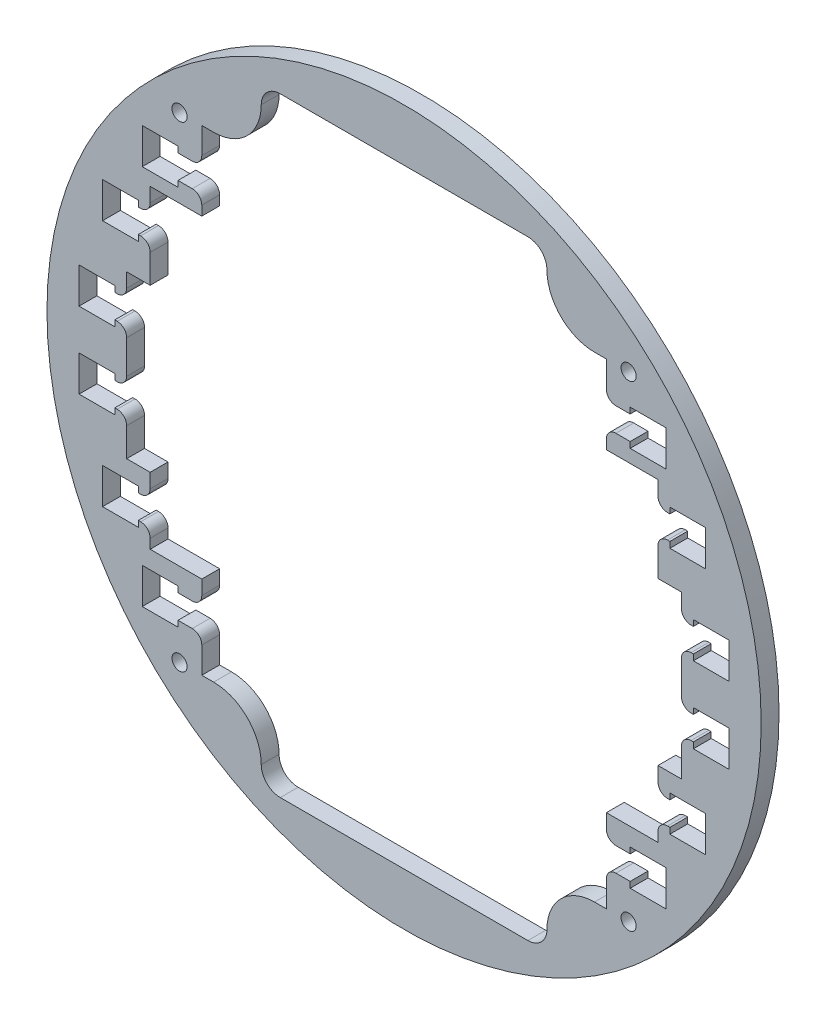
from build123d import *

# Parameters (mm, degrees)
SKETCH1_R                  = 95.25
BOSS_EXTRUDE1_DEPTH        = 4.7625
CUT_EXTRUDE1_DEPTH         = 135.788005424
SKETCH12_W                 = 136.486274728
SKETCH12_H                 = 6.35
SKETCH12_W_2               = 157.666649448
SKETCH12_W_3               = 170.194766776
CUT_EXTRUDE2_DEPTH         = 135.788005424
CUT_EXTRUDE3_DEPTH         = 135.788005424
F_10_32_TAPPED_HOLE1_D     = 4.0386
F_10_32_TAPPED_HOLE1_DEPTH = 11.938
SKETCH14_W                 = 76.2
SKETCH14_H                 = 162.56
CUT_EXTRUDE4_DEPTH         = 135.788005424
FILLET1_R                  = 12.7
FILLET2_R                  = 5.08
FILLET3_R                  = 2.54


with BuildPart() as part:
    # Sketch1 → Boss-Extrude1 (new body)
    with BuildSketch(Plane.XY):
        with Locations(Location((0, 0, 0), (0, 0, 180))):
            Circle(SKETCH1_R)
    extrude(amount=BOSS_EXTRUDE1_DEPTH)

    # Sketch11 → Cut-Extrude1 (cut, through all)
    with BuildSketch(Plane.XY.offset(4.7625)):
        Polygon((-69.830637364, 55.5625), (-69.830637364, 46.0375), (-60.305637364, 46.0375), (-60.305637364, 47.625), (-68.243137364, 47.625), (-68.243137364, 53.975), (-60.305637364, 53.975), (-60.305637364, 55.5625), align=None)
        Polygon((-86.684883388, 14.9225), (-86.684883388, 5.3975), (-77.159883388, 5.3975), (-77.159883388, 6.985), (-85.097383388, 6.985), (-85.097383388, 13.335), (-77.159883388, 13.335), (-77.159883388, 14.9225), align=None)
        Polygon((-80.420824724, 37.7825), (-80.420824724, 28.2575), (-70.895824724, 28.2575), (-70.895824724, 29.845), (-78.833324724, 29.845), (-78.833324724, 36.195), (-70.895824724, 36.195), (-70.895824724, 37.7825), align=None)
        Polygon((-77.159883388, -13.335), (-77.159883388, -14.9225), (-86.684883388, -14.9225), (-86.684883388, -5.3975), (-77.159883388, -5.3975), (-77.159883388, -6.985), (-85.097383388, -6.985), (-85.097383388, -13.335), align=None)
        Polygon((-80.420824724, -28.2575), (-70.895824724, -28.2575), (-70.895824724, -29.845), (-78.833324724, -29.845), (-78.833324724, -36.195), (-70.895824724, -36.195), (-70.895824724, -37.7825), (-80.420824724, -37.7825), align=None)
        Polygon((-60.305637364, -46.0375), (-60.305637364, -47.625), (-68.243137364, -47.625), (-68.243137364, -53.975), (-60.305637364, -53.975), (-60.305637364, -55.5625), (-69.830637364, -55.5625), (-69.830637364, -46.0375), align=None)
        Polygon((60.305637364, -53.975), (60.305637364, -55.5625), (69.830637364, -55.5625), (69.830637364, -46.0375), (60.305637364, -46.0375), (60.305637364, -47.625), (68.243137364, -47.625), (68.243137364, -53.975), align=None)
        Polygon((70.895824724, -36.195), (70.895824724, -37.7825), (80.420824724, -37.7825), (80.420824724, -28.2575), (70.895824724, -28.2575), (70.895824724, -29.845), (78.833324724, -29.845), (78.833324724, -36.195), align=None)
        Polygon((86.684883388, -5.3975), (77.159883388, -5.3975), (77.159883388, -6.985), (85.097383388, -6.985), (85.097383388, -13.335), (77.159883388, -13.335), (77.159883388, -14.9225), (86.684883388, -14.9225), align=None)
        Polygon((70.895824724, 37.7825), (80.420824724, 37.7825), (80.420824724, 28.2575), (70.895824724, 28.2575), (70.895824724, 29.845), (78.833324724, 29.845), (78.833324724, 36.195), (70.895824724, 36.195), align=None)
        Polygon((77.159883388, 14.9225), (86.684883388, 14.9225), (86.684883388, 5.3975), (77.159883388, 5.3975), (77.159883388, 6.985), (85.097383388, 6.985), (85.097383388, 13.335), (77.159883388, 13.335), align=None)
        Polygon((60.305637364, 55.5625), (69.830637364, 55.5625), (69.830637364, 46.0375), (60.305637364, 46.0375), (60.305637364, 47.625), (68.243137364, 47.625), (68.243137364, 53.975), (60.305637364, 53.975), align=None)
    extrude(amount=-CUT_EXTRUDE1_DEPTH, mode=Mode.SUBTRACT)

    # Sketch12 → Cut-Extrude2 (cut, through all)
    with BuildSketch(Plane.XY.offset(4.7625)):
        with Locations((0, 50.8)):
            Rectangle(SKETCH12_W, SKETCH12_H)
        with Locations((0, 33.02)):
            Rectangle(SKETCH12_W_2, SKETCH12_H)
        with Locations((0, 10.16)):
            Rectangle(SKETCH12_W_3, SKETCH12_H)
        with Locations((0, -10.16)):
            Rectangle(SKETCH12_W_3, SKETCH12_H)
        with Locations((0, -33.02)):
            Rectangle(SKETCH12_W_2, SKETCH12_H)
        with Locations((0, -50.8)):
            Rectangle(SKETCH12_W, SKETCH12_H)
    extrude(amount=-CUT_EXTRUDE2_DEPTH, mode=Mode.SUBTRACT)

    # Sketch13 → Cut-Extrude3 (cut, through all)
    with BuildSketch(Plane.XY.offset(4.7625)):
        Polygon((53.955637364, 42.545), (67.720824724, 42.545), (67.720824724, 19.685), (73.984883388, 19.685), (73.984883388, -23.495), (67.720824724, -23.495), (67.720824724, -41.275), (53.955637364, -41.275), (53.955637364, -63.5), (-53.955637364, -63.5), (-53.955637364, -41.275), (-67.720824724, -41.275), (-67.720824724, -23.495), (-73.984883388, -23.495), (-73.984883388, 19.685), (-67.720824724, 19.685), (-67.720824724, 42.545), (-53.955637364, 42.545), (-53.955637364, 63.5), (53.955637364, 63.5), align=None)
    extrude(amount=-CUT_EXTRUDE3_DEPTH, mode=Mode.SUBTRACT)

    # #10-32 Tapped Hole1
    with Locations(Plane.XY.offset(4.7625)):
        with Locations((-59.89185243, 63.5), (59.89185243, 63.5)):
            f_10_32_tapped_hole1 = Hole(F_10_32_TAPPED_HOLE1_D / 2, depth=F_10_32_TAPPED_HOLE1_DEPTH)

    # Mirror1: #10-32 Tapped Hole1 across plane
    add(f_10_32_tapped_hole1.mirror(Plane.ZX), mode=Mode.SUBTRACT)

    # Sketch14 → Cut-Extrude4 (cut, through all)
    with BuildSketch(Plane.XY.offset(4.7625)):
        Rectangle(SKETCH14_W, SKETCH14_H)
    extrude(amount=-CUT_EXTRUDE4_DEPTH, mode=Mode.SUBTRACT)

    # Fillet1
    fillet1_edges = [part.edges().sort_by_distance(p)[0] for p in [
        (38.1, 63.5, 2.38125),
        (-38.1, 63.5, 2.38125),
        (-38.1, -63.5, 2.38125),
        (38.1, -63.5, 2.38125),
    ]]
    fillet(fillet1_edges, radius=FILLET1_R)

    # Fillet2
    fillet2_edges = [part.edges().sort_by_distance(p)[0] for p in [
        (38.1, -81.28, 2.38125),
        (-38.1, -81.28, 2.38125),
        (38.1, 81.28, 2.38125),
        (-38.1, 81.28, 2.38125),
    ]]
    fillet(fillet2_edges, radius=FILLET2_R - 0.0001)  # a hair under: the kernel refuses the full size

    # Fillet3
    fillet3_edges = [part.edges().sort_by_distance(p)[0] for p in [
        (-53.955637364, -47.625, 2.38125),
        (53.955637364, -47.625, 2.38125),
        (-67.720824724, -29.845, 2.38125),
        (67.720824724, -29.845, 2.38125),
        (-73.984883388, -13.335, 2.38125),
        (73.984883388, -13.335, 2.38125),
        (-67.720824724, 36.195, 2.38125),
        (67.720824724, 36.195, 2.38125),
        (53.955637364, 53.975, 2.38125),
        (-53.955637364, 53.975, 2.38125),
        (53.955637364, 47.625, 2.38125),
        (-67.720824724, 29.845, 2.38125),
        (73.984883388, 6.985, 2.38125),
        (73.984883388, 13.335, 2.38125),
        (-73.984883388, 6.985, 2.38125),
        (-73.984883388, -6.985, 2.38125),
        (-73.984883388, 13.335, 2.38125),
        (-67.720824724, -36.195, 2.38125),
        (53.955637364, -53.975, 2.38125),
        (67.720824724, 29.845, 2.38125),
        (73.984883388, -6.985, 2.38125),
        (67.720824724, -36.195, 2.38125),
        (-53.955637364, -53.975, 2.38125),
        (-53.955637364, 47.625, 2.38125),
    ]]
    fillet(fillet3_edges, radius=FILLET3_R)


solid = part.part
